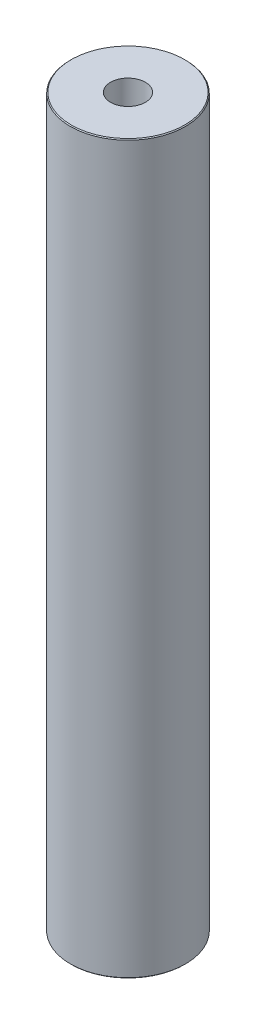
from build123d import *

# Parameters (mm, degrees)
SKETCH1_R           = 47.5
BOSS_EXTRUDE1_DEPTH = 600
SKETCH2_R           = 14.371323885
CUT_EXTRUDE1_DEPTH  = 604.748706003
CHAMFER1_SIZE       = 0.712888126


with BuildPart() as part:
    # Sketch1 → Boss-Extrude1 (new body)
    with BuildSketch(Plane(origin=(0, 0, 0), x_dir=(1, 0, 0), z_dir=(0, 1, 0))):
        Circle(SKETCH1_R)
    extrude(amount=BOSS_EXTRUDE1_DEPTH)

    # Sketch2 → Cut-Extrude1 (cut, through all)
    with BuildSketch(Plane(origin=(0, 0, 0), x_dir=(1, 0, 0), z_dir=(0, 1, 0))):
        Circle(SKETCH2_R)
    extrude(amount=CUT_EXTRUDE1_DEPTH, mode=Mode.SUBTRACT)

    # Chamfer1
    chamfer1_edges = [part.edges().sort_by_distance(p)[0] for p in [
        (-47.5, 600, 0),
        (-47.5, 0, 0),
    ]]
    chamfer(chamfer1_edges, length=CHAMFER1_SIZE)


solid = part.part
